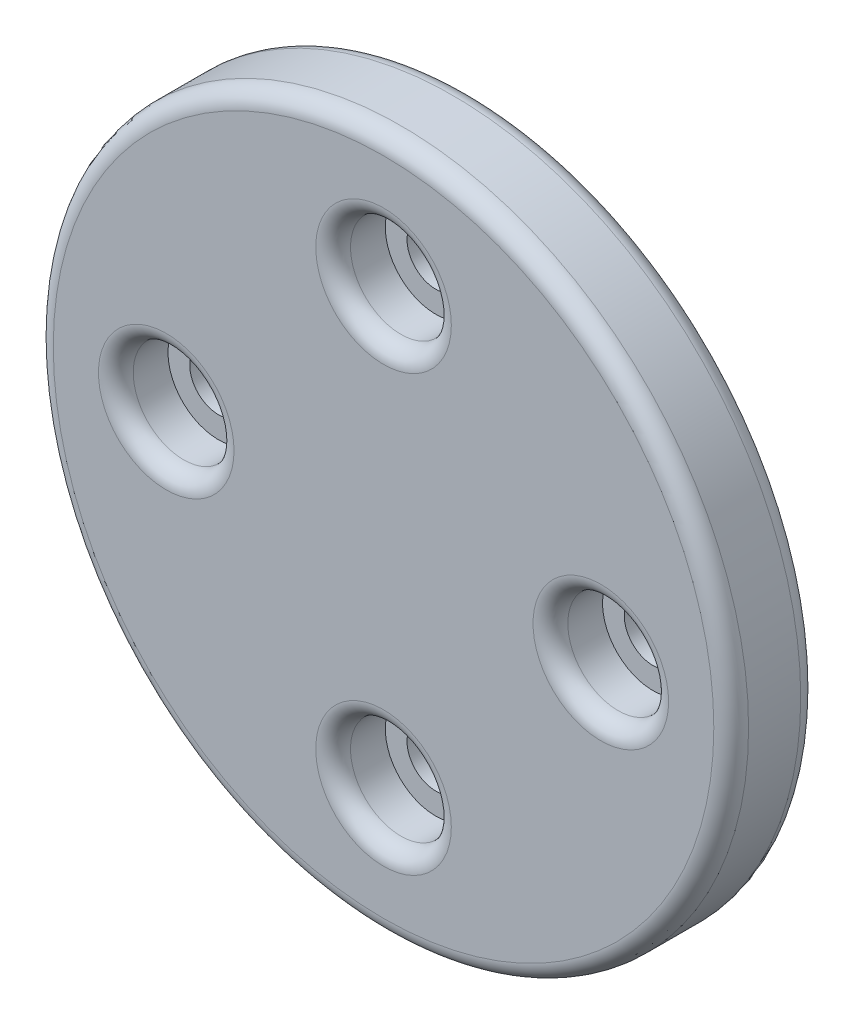
from build123d import *

# Parameters (mm, degrees)
SKIZZE1_R                       = 20
SKIZZE1_R_2                     = 1.65
AUFSATZ_LINEAR_AUSTRAGEN1_DEPTH = 5
SKIZZE2_R                       = 2.9
SCHNITT_LINEAR_AUSTRAGEN1_DEPTH = 3
VERRUNDUNG1_R                   = 1


with BuildPart() as part:
    # Skizze1 → Aufsatz-Linear austragen1 (new body)
    with BuildSketch(Plane.XY):
        Circle(SKIZZE1_R)
        with Locations((0, -12.5)):
            Circle(SKIZZE1_R_2, mode=Mode.SUBTRACT)
        with Locations((-12.5, 0)):
            Circle(SKIZZE1_R_2, mode=Mode.SUBTRACT)
        with Locations((12.5, 0)):
            Circle(SKIZZE1_R_2, mode=Mode.SUBTRACT)
        with Locations((0, 12.5)):
            Circle(SKIZZE1_R_2, mode=Mode.SUBTRACT)
    extrude(amount=AUFSATZ_LINEAR_AUSTRAGEN1_DEPTH)

    # Skizze2 → Schnitt-Linear austragen1 (cut)
    with BuildSketch(Plane.XY.offset(5)):
        with Locations((0, 12.5)):
            Circle(SKIZZE2_R)
        with Locations((12.5, 0)):
            Circle(SKIZZE2_R)
        with Locations((0, -12.5)):
            Circle(SKIZZE2_R)
        with Locations((-12.5, 0)):
            Circle(SKIZZE2_R)
    extrude(amount=-SCHNITT_LINEAR_AUSTRAGEN1_DEPTH, mode=Mode.SUBTRACT)

    # Verrundung1
    verrundung1_edges = [part.edges().sort_by_distance(p)[0] for p in [
        (-20, 0, 0),
        (10.85, 0, 0),
        (-1.65, -12.5, 0),
        (-14.15, 0, 0),
        (-1.65, 12.5, 0),
        (-20, 0, 5),
        (-15.4, 0, 5),
        (-2.9, -12.5, 5),
        (9.6, 0, 5),
        (-2.9, 12.5, 5),
    ]]
    fillet(verrundung1_edges, radius=VERRUNDUNG1_R)


solid = part.part
